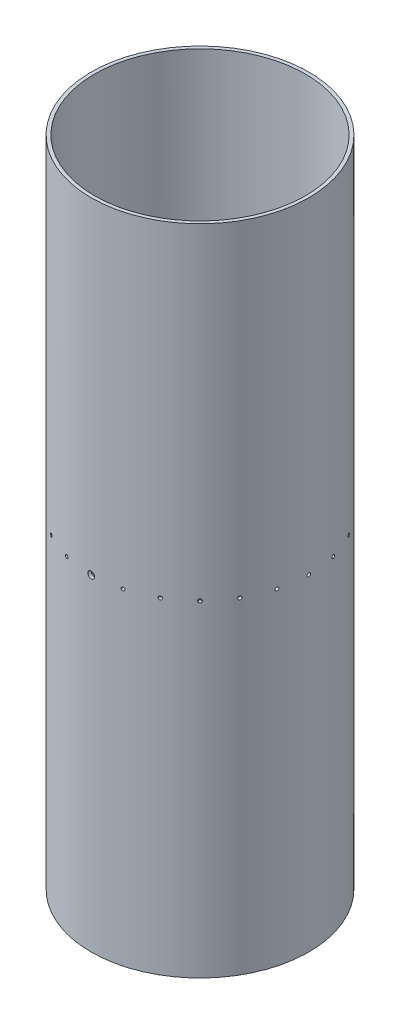
from build123d import *

# Parameters (mm, degrees)
SKETCH1_R               = 101.6
SKETCH1_R_2             = 98.425
BOSS_EXTRUDE1_DEPTH     = 609.6
CUT_EXTRUDE1_DEPTH      = 627.304462702
CUT_EXTRUDE1_DEPTH_BACK = 627.304462702
SKETCH2_R               = 3.175
SKETCH3_R               = 1.5875
CUT_EXTRUDE2_DEPTH      = 609.6
CIRPATTERN1_COUNT       = 24


with BuildPart() as part:
    # Sketch1 → Boss-Extrude1 (new body)
    with BuildSketch(Plane(origin=(0, 0, 0), x_dir=(1, 0, 0), z_dir=(0, 1, 0))):
        Circle(SKETCH1_R)
        Circle(SKETCH1_R_2, mode=Mode.SUBTRACT)
    extrude(amount=BOSS_EXTRUDE1_DEPTH)

    # Sketch2 → Cut-Extrude1 (cut, two sides: drawn at the far end of the back side and taken through both)
    with BuildSketch(Plane.XY.offset(-CUT_EXTRUDE1_DEPTH_BACK)):
        with Locations((0, 304.8)):
            Circle(SKETCH2_R)
    extrude(amount=CUT_EXTRUDE1_DEPTH + CUT_EXTRUDE1_DEPTH_BACK, mode=Mode.SUBTRACT)

    # Sketch3 → Cut-Extrude2 (cut)
    with BuildSketch(Plane(origin=(0, 0, 0), x_dir=(0, 0, -1), z_dir=(1, 0, 0))):
        with Locations((0, 304.8)):
            Circle(SKETCH3_R)
    cut_extrude2 = extrude(amount=-CUT_EXTRUDE2_DEPTH, mode=Mode.SUBTRACT)

    # CirPattern1: Cut-Extrude2 ×24 about axis
    cirpattern1_axis = Axis((0, 0, 0), (0, 1, 0))
    for i in range(1, CIRPATTERN1_COUNT):
        add(cut_extrude2.rotate(cirpattern1_axis, i * 360 / CIRPATTERN1_COUNT), mode=Mode.SUBTRACT)


solid = part.part
